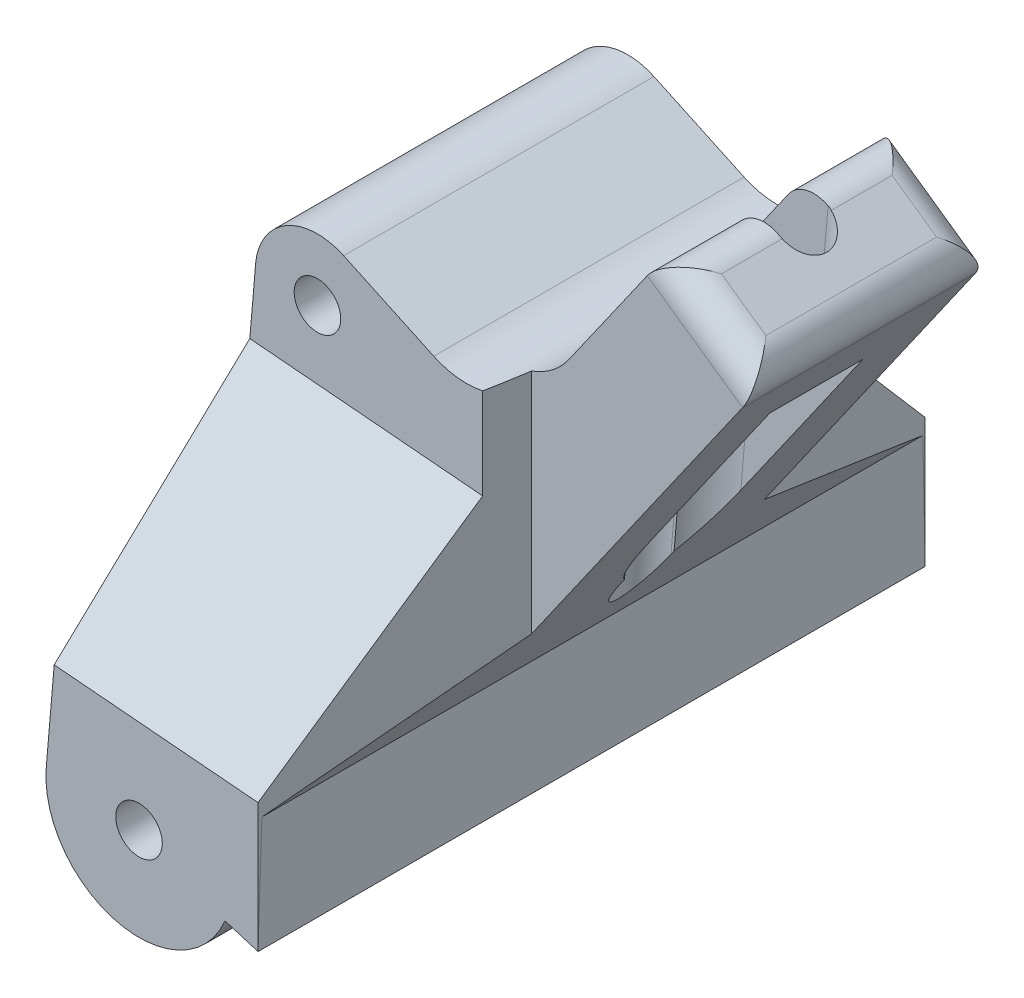
from build123d import *

# Parameters (mm, degrees)
SKETCH2_R                 = 1.5
MAIN_EXTRUDE_DEPTH        = 21.5
HORIZONTAL_CUT_DEPTH      = 48.59062889
HORIZONTAL_CUT_DEPTH_BACK = 48.59062889
SKETCH5_OUTSIDE_W         = 47.542
SKETCH5_OUTSIDE_H         = 58.496
VERTICAL_CUT_DEPTH        = 15.063100578
END_FILLET_R              = 2
SPRING_PLACE_CUT_DEPTH    = 14
FILLET5_R                 = 10
FILLET4_R                 = 5
CUT_EXTRUDE1_DEPTH        = 52.882041504
CUT_EXTRUDE2_START        = -16.243126
CUT_EXTRUDE2_DEPTH        = 16.243126


# Read off the part's stored shape, not the designer's step: vertical-cut
with BuildPart() as part:
    # Sketch2 → main-extrude (new, symmetric)
    with BuildSketch(Plane.XY):
        with BuildLine():
            Line((26.046045858, 30.659682992), (19.902405526, 34.961506265))
            Line((19.902405526, 34.961506265), (11.298758981, 22.6742256))
            Line((11.298758981, 22.6742256), (1.690473047, 27.154642913))
            ThreePointArc((1.690473047, 27.154642913), (-2.003746596, 26.991347579), (-3.985523805, 23.869411765))
            Line((-3.985523805, 23.869411765), (-5.978285707, 0.51))
            ThreePointArc((-5.978285707, 0.51), (-1.419809226, -5.829591904), (5.543277195, -2.296100594))
            Line((5.543277195, -2.296100594), (7.669311717, -2.952527164))
            Line((7.669311717, -2.952527164), (7.722039638, 4.490290033))
            Line((7.722039638, 4.490290033), (26.046045858, 30.659682992))
        make_face()
        Circle(SKETCH2_R, mode=Mode.SUBTRACT)
        with Locations((0, 23.529411765)):
            Circle(SKETCH2_R, mode=Mode.SUBTRACT)
    extrude(amount=MAIN_EXTRUDE_DEPTH, both=True)

    # Sketch5 outside → horizontal-cut (cut, two sides: drawn at the far end of the back side and taken through both)
    with BuildSketch(Plane(origin=(0, 27.529411765, 0), x_dir=(-1, 0, 0), z_dir=(0, -1, 0)).offset(-HORIZONTAL_CUT_DEPTH_BACK)):
        with Locations((-10.023, 0)):
            Rectangle(SKETCH5_OUTSIDE_W, SKETCH5_OUTSIDE_H)
        Polygon((-5.543277195, -21.5), (6, -21.5), (6, 21.5), (-5.543277195, 21.5), (-7.669311717, 21.5), (-11.298758981, 7.5), (-26.046045858, 7.5), (-26.046045858, -7.5), (-11.298758981, -7.5), (-7.669311717, -21.5), align=None, mode=Mode.SUBTRACT)
    extrude(amount=HORIZONTAL_CUT_DEPTH + HORIZONTAL_CUT_DEPTH_BACK, mode=Mode.SUBTRACT)

    # vertical-cut outline → vertical-cut (cut)
    with BuildSketch(Plane(origin=(-1.956623805, 47.652438964, 0), x_dir=(0, 0, 1), z_dir=(0.9963809512430475, -0.08499999999999992, 0))):
        Polygon((10, 28.250815058), (10, 18), (21.5, 18), (21.5, 41.313669441), align=None)
        Polygon((-21.5, 18), (-10, 18), (-10, 28.250815058), (-21.5, 41.313669441), align=None)
    extrude(amount=VERTICAL_CUT_DEPTH, mode=Mode.SUBTRACT)

    # end-fillet
    end_fillet_edges = [part.edges().sort_by_distance(p)[0] for p in [
        (19.902405526, 34.961506265, 0),
        (26.046045858, 30.659682992, 0),
        (22.974225692, 32.810594628, 7.5),
        (22.974225692, 32.810594628, -7.5),
    ]]
    fillet(end_fillet_edges, radius=END_FILLET_R)

    # Sketch13 → spring-place-cut (cut, symmetric)
    with BuildSketch(Plane.XY):
        with BuildLine():
            Line((4.750311853, 13.645607612), (-4.788285707, 14.459333317))
            Line((-4.788285707, 14.459333317), (-5.468285707, 6.488285707))
            Line((-5.468285707, 6.488285707), (-5.978285707, 0.51))
            ThreePointArc((-5.978285707, 0.51), (-1.419809226, -5.829591904), (5.543277195, -2.296100594))
            Line((5.543277195, -2.296100594), (5.568173284, -2.303787419))
            Line((5.568173284, -2.303787419), (5.732956787, -1.770086573))
            ThreePointArc((5.732956787, -1.770086573), (5.96812639, -0.61763047), (5.973944242, 0.558560826))
            Line((5.973944242, 0.558560826), (4.750311853, 13.645607612))
        make_face()
    extrude(amount=SPRING_PLACE_CUT_DEPTH, both=True, mode=Mode.SUBTRACT)

    # Fillet5
    fillet5_edges = [part.edges().sort_by_distance(p)[0] for p in [
        (-0.018986927, 14.052470465, 14),
        (-0.018986927, 14.052470465, -14),
    ]]
    fillet(fillet5_edges, radius=FILLET5_R)

    # Fillet4
    # the kernel refuses this fillet: 5 mm, written as the material it adds along each edge
    with BuildSketch(Plane(origin=(11.298758981, 22.6742256, -17.98874539), x_dir=(-0.9063077870366477, 0.42261826174070405, 0), z_dir=(0, 0, 1))) as fillet4_piece_1_section:
        with BuildLine():
            CenterArc((FILLET4_R * 0.839099631177, -FILLET4_R), FILLET4_R, 90, 80)
            Line((-FILLET4_R * 0.145708121835, -FILLET4_R * 0.826351822333), (0, 0))
            Line((0, 0), (FILLET4_R * 0.839099631177, 0))
        make_face()
    fillet4_piece_1 = extrude(amount=25.48874539, mode=Mode.PRIVATE)
    fillet4_piece_1 = split(fillet4_piece_1, bisect_by=Plane(origin=(9.938648559, 23.630642265, -10), z_dir=(0, 0, 1)), keep=Keep.TOP, mode=Mode.PRIVATE)
    fillet4_piece_1 = split(fillet4_piece_1, bisect_by=Plane(origin=(10.933336463, 23.630642265, -8.909557674), z_dir=(-0.9679999612731994, 0, 0.25095034364408525)), keep=Keep.TOP, mode=Mode.PRIVATE)
    fillet4_piece_1 = split(fillet4_piece_1, bisect_by=Plane(origin=(9.938648559, 23.630642265, -7.5), z_dir=(0, 0, -1)), keep=Keep.TOP, mode=Mode.PRIVATE)
    add(fillet4_piece_1)
    with BuildSketch(Plane(origin=(11.298758981, 22.6742256, -7.5), x_dir=(-0.9063077870366477, 0.42261826174070405, 0), z_dir=(0, 0, 1))) as fillet4_piece_2_section:
        with BuildLine():
            CenterArc((FILLET4_R * 0.839099631177, -FILLET4_R), FILLET4_R, 90, 80)
            Line((-FILLET4_R * 0.145708121835, -FILLET4_R * 0.826351822333), (0, 0))
            Line((0, 0), (FILLET4_R * 0.839099631177, 0))
        make_face()
    fillet4_piece_2 = extrude(amount=15, mode=Mode.PRIVATE)
    fillet4_piece_2 = split(fillet4_piece_2, bisect_by=Plane(origin=(13.081425039, 23.673797808, 0.623656853), z_dir=(-0.9679999612731994, 0, -0.2509503436440852)), keep=Keep.TOP, mode=Mode.PRIVATE)
    fillet4_piece_2 = split(fillet4_piece_2, bisect_by=Plane(origin=(13.081425039, 23.673797808, -0.623656853), z_dir=(-0.9679999612731994, 0, 0.25095034364408525)), keep=Keep.TOP, mode=Mode.PRIVATE)
    add(fillet4_piece_2)
    with BuildSketch(Plane(origin=(11.298758981, 22.6742256, -7.5), x_dir=(-0.9063077870366477, 0.42261826174070405, 0), z_dir=(0, 0, 1))) as fillet4_piece_3_section:
        with BuildLine():
            CenterArc((FILLET4_R * 0.839099631177, -FILLET4_R), FILLET4_R, 90, 80)
            Line((-FILLET4_R * 0.145708121835, -FILLET4_R * 0.826351822333), (0, 0))
            Line((0, 0), (FILLET4_R * 0.839099631177, 0))
        make_face()
    fillet4_piece_3 = extrude(amount=15, mode=Mode.PRIVATE)
    fillet4_piece_3 = split(fillet4_piece_3, bisect_by=Plane(origin=(14.480371863, 24.591366471, -4.772552021), z_dir=(-0.9679999612731994, 0, -0.2509503436440852)), keep=Keep.TOP, mode=Mode.PRIVATE)
    fillet4_piece_3 = split(fillet4_piece_3, bisect_by=Plane(origin=(11.912432267, 24.591366471, -5.132855534), z_dir=(0.9679999612731994, 0, -0.25095034364408525)), keep=Keep.TOP, mode=Mode.PRIVATE)
    add(fillet4_piece_3)
    with BuildSketch(Plane(origin=(11.298758981, 22.6742256, -7.5), x_dir=(-0.9063077870366477, 0.42261826174070405, 0), z_dir=(0, 0, 1))) as fillet4_piece_4_section:
        with BuildLine():
            CenterArc((FILLET4_R * 0.839099631177, -FILLET4_R), FILLET4_R, 90, 80)
            Line((-FILLET4_R * 0.145708121835, -FILLET4_R * 0.826351822333), (0, 0))
            Line((0, 0), (FILLET4_R * 0.839099631177, 0))
        make_face()
    fillet4_piece_4 = extrude(amount=15, mode=Mode.PRIVATE)
    fillet4_piece_4 = split(fillet4_piece_4, bisect_by=Plane(origin=(11.912432267, 24.591366471, 5.132855534), z_dir=(0.9679999612731994, 0, 0.2509503436440852)), keep=Keep.TOP, mode=Mode.PRIVATE)
    fillet4_piece_4 = split(fillet4_piece_4, bisect_by=Plane(origin=(14.480371863, 24.591366471, 4.772552021), z_dir=(-0.9679999612731994, 0, 0.25095034364408525)), keep=Keep.TOP, mode=Mode.PRIVATE)
    add(fillet4_piece_4)
    with BuildSketch(Plane(origin=(11.298758981, 22.6742256, -7.5), x_dir=(-0.9063077870366477, 0.42261826174070405, 0), z_dir=(0, 0, 1))) as fillet4_piece_5_section:
        with BuildLine():
            CenterArc((FILLET4_R * 0.839099631177, -FILLET4_R), FILLET4_R, 90, 80)
            Line((-FILLET4_R * 0.145708121835, -FILLET4_R * 0.826351822333), (0, 0))
            Line((0, 0), (FILLET4_R * 0.839099631177, 0))
        make_face()
    fillet4_piece_5 = extrude(amount=25.48874539, mode=Mode.PRIVATE)
    fillet4_piece_5 = split(fillet4_piece_5, bisect_by=Plane(origin=(9.938648559, 23.630642265, 10), z_dir=(0, 0, -1)), keep=Keep.TOP, mode=Mode.PRIVATE)
    fillet4_piece_5 = split(fillet4_piece_5, bisect_by=Plane(origin=(10.933336463, 23.630642265, 8.909557674), z_dir=(-0.9679999612731994, 0, -0.2509503436440852)), keep=Keep.TOP, mode=Mode.PRIVATE)
    fillet4_piece_5 = split(fillet4_piece_5, bisect_by=Plane(origin=(9.938648559, 23.630642265, 7.5), z_dir=(0, 0, 1)), keep=Keep.TOP, mode=Mode.PRIVATE)
    add(fillet4_piece_5)
    with BuildSketch(Plane(origin=(11.298758981, 22.6742256, -7.5), x_dir=(-0.9063077870366477, 0.42261826174070405, 0), z_dir=(0, 0, 1))) as fillet4_piece_6_section:
        with BuildLine():
            CenterArc((FILLET4_R * 0.839099631177, -FILLET4_R), FILLET4_R, 90, 80)
            Line((-FILLET4_R * 0.145708121835, -FILLET4_R * 0.826351822333), (0, 0))
            Line((0, 0), (FILLET4_R * 0.839099631177, 0))
        make_face()
    fillet4_piece_6 = extrude(amount=15, mode=Mode.PRIVATE)
    fillet4_piece_6 = split(fillet4_piece_6, bisect_by=Plane(origin=(13.263621158, 25.832677019, -0.079134917), z_dir=(0.9679999612731994, 0, 0.2509503436440852)), keep=Keep.TOP, mode=Mode.PRIVATE)
    fillet4_piece_6 = split(fillet4_piece_6, bisect_by=Plane(origin=(13.263621158, 25.832677019, 0.079134917), z_dir=(0.9679999612731994, 0, -0.25095034364408525)), keep=Keep.TOP, mode=Mode.PRIVATE)
    add(fillet4_piece_6)

    # Sketch16 → Cut-Extrude1 (cut, through all)
    with BuildSketch(Plane(origin=(3.042409669, 35.663518124, 0), x_dir=(0.9963809512430474, -0.08499999999999996, 0), z_dir=(0.08499999999999996, 0.9963809512430474, 0))):
        with BuildLine():
            Line((18.345710894, -1.6), (10.345710894, -1.6))
            ThreePointArc((10.345710894, -1.6), (8.745710894, 0), (10.345710894, 1.6))
            Line((10.345710894, 1.6), (18.345710894, 1.6))
            ThreePointArc((18.345710894, 1.6), (19.945710894, 0), (18.345710894, -1.6))
        make_face()
    extrude(amount=-CUT_EXTRUDE1_DEPTH, mode=Mode.SUBTRACT)

    # Sketch17 → Cut-Extrude2 (cut)
    with BuildSketch(Plane(origin=(2.286753534, 26.80561955, 0), x_dir=(0.9963809512430474, -0.08499999999999996, 0), z_dir=(0.08499999999999996, 0.9963809512430474, 0)).offset(CUT_EXTRUDE2_START)):
        with BuildLine():
            Line((24.627792818, 3), (13.058532698, 3))
            ThreePointArc((13.058532698, 3), (10.058532698, 0), (13.058532698, -3))
            Line((13.058532698, -3), (24.627792818, -3))
            ThreePointArc((24.627792818, -3), (27.627792818, 0), (24.627792818, 3))
        make_face()
    extrude(amount=CUT_EXTRUDE2_DEPTH, mode=Mode.SUBTRACT)


solid = part.part
